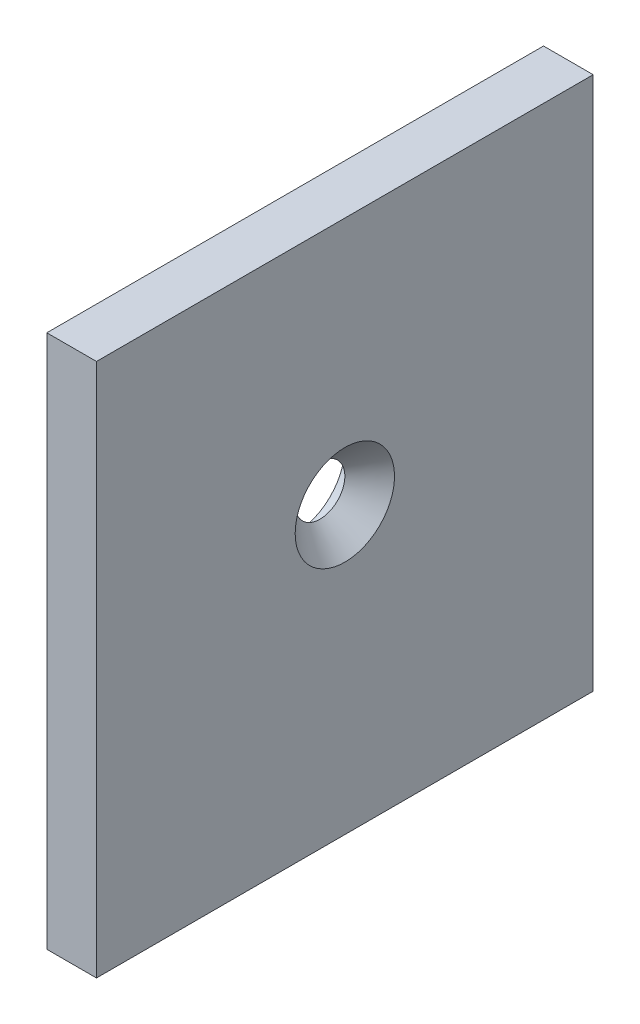
from build123d import *

# Parameters (mm, degrees)
ESQUISSE1_W      = 4
ESQUISSE1_H      = 43
EXTRUSION1_DEPTH = 40
ESQUISSE2_R      = 2
EXTRUSION2_DEPTH = 59.864250611
ESQUISSE4_R      = 4
EXTRUSION3_DEPTH = 2
CHANFREIN1_SIZE  = 2


with BuildPart() as part:
    # Esquisse1 → Extrusion1 (new body)
    with BuildSketch(Plane.XY):
        with Locations((2, 21.5)):
            Rectangle(ESQUISSE1_W, ESQUISSE1_H)
    extrude(amount=EXTRUSION1_DEPTH)

    # Esquisse2 → Extrusion2 (cut, through all)
    with BuildSketch(Plane.ZY):
        with Locations((20, 23)):
            Circle(ESQUISSE2_R)
    extrude(amount=-EXTRUSION2_DEPTH, mode=Mode.SUBTRACT)

    # Esquisse4 → Extrusion3 (cut)
    with BuildSketch(Plane.ZY):
        with Locations((20, 23)):
            Circle(ESQUISSE4_R)
    extrude(amount=-EXTRUSION3_DEPTH, mode=Mode.SUBTRACT)

    # Chanfrein1
    chanfrein1_edges = [part.edges().sort_by_distance(p)[0] for p in [
        (4, 23, 18),
    ]]
    chamfer(chanfrein1_edges, length=CHANFREIN1_SIZE - 0.0001)  # a hair under: the kernel refuses the full size


solid = part.part
